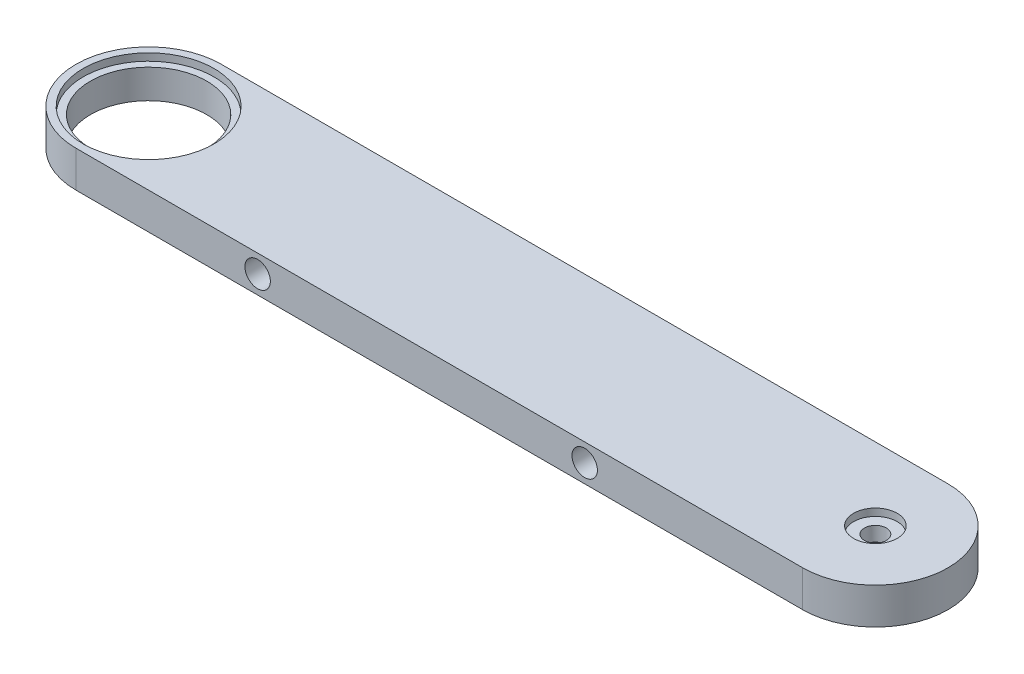
from build123d import *

# Parameters (mm, degrees)
BOSS_EXTRUDE1_DEPTH = 5
SKETCH2_R           = 4
CUT_EXTRUDE1_DEPTH  = 2
SKETCH3_R           = 3
CUT_EXTRUDE2_DEPTH  = 1
SKETCH6_R           = 1.5
CUT_EXTRUDE5_DEPTH  = 71.823724839
SKETCH7_R           = 8
CUT_EXTRUDE6_DEPTH  = 71.887234394
SKETCH8_R           = 9
CUT_EXTRUDE7_DEPTH  = 1
CUT_EXTRUDE8_DEPTH  = 71.887234394
SKETCH10_R          = 1.75
CUT_EXTRUDE9_DEPTH  = 8


with BuildPart() as part:
    # Sketch1 → Boss-Extrude1 (new body)
    with BuildSketch(Plane(origin=(0, 0, 0), x_dir=(1, 0, 0), z_dir=(0, 1, 0))):
        with BuildLine():
            Line((-50, 10), (-60, 10))
            ThreePointArc((-60, 10), (-70, 0), (-60, -10))
            Line((-60, -10), (50, -10))
            ThreePointArc((50, -10), (60, 0), (50, 10))
            Line((50, 10), (-50, 10))
        make_face()
    extrude(amount=BOSS_EXTRUDE1_DEPTH)

    # Sketch2 → Cut-Extrude1 (cut)
    with BuildSketch(Plane.XZ):
        with Locations((50, 0)):
            Circle(SKETCH2_R)
    extrude(amount=-CUT_EXTRUDE1_DEPTH, mode=Mode.SUBTRACT)

    # Sketch3 → Cut-Extrude2 (cut)
    with BuildSketch(Plane(origin=(0, 5, 0), x_dir=(1, 0, 0), z_dir=(0, 1, 0))):
        with Locations((50, 0)):
            Circle(SKETCH3_R)
    extrude(amount=-CUT_EXTRUDE2_DEPTH, mode=Mode.SUBTRACT)

    # Sketch6 → Cut-Extrude5 (cut, through all)
    with BuildSketch(Plane(origin=(0, 4, 0), x_dir=(1, 0, 0), z_dir=(0, 1, 0))):
        with Locations((50, 0)):
            Circle(SKETCH6_R)
    extrude(amount=-CUT_EXTRUDE5_DEPTH, mode=Mode.SUBTRACT)

    # Sketch7 → Cut-Extrude6 (cut, through all)
    with BuildSketch(Plane(origin=(0, 5, 0), x_dir=(1, 0, 0), z_dir=(0, 1, 0))):
        with Locations((-50, 0)):
            Circle(SKETCH7_R)
    extrude(amount=-CUT_EXTRUDE6_DEPTH, mode=Mode.SUBTRACT)

    # Sketch8 → Cut-Extrude7 (cut)
    with BuildSketch(Plane(origin=(0, 5, 0), x_dir=(1, 0, 0), z_dir=(0, 1, 0))):
        with Locations((-50, 0)):
            Circle(SKETCH8_R)
    extrude(amount=-CUT_EXTRUDE7_DEPTH, mode=Mode.SUBTRACT)

    # Sketch9 → Cut-Extrude8 (cut, through all)
    with BuildSketch(Plane(origin=(0, 5, 0), x_dir=(1, 0, 0), z_dir=(0, 1, 0))):
        with BuildLine():
            Line((-50, -10), (-60, -10))
            ThreePointArc((-60, -10), (-70, 0), (-60, 10))
            Line((-60, 10), (-50, 10))
            ThreePointArc((-50, 10), (-60, 0), (-50, -10))
        make_face()
    extrude(amount=-CUT_EXTRUDE8_DEPTH, mode=Mode.SUBTRACT)

    # Sketch10 → Cut-Extrude9 (cut)
    with BuildSketch(Plane.XY.offset(10)):
        with Locations((-25, 2.5)):
            Circle(SKETCH10_R)
        with Locations((20, 2.5)):
            Circle(SKETCH10_R)
    extrude(amount=-CUT_EXTRUDE9_DEPTH, mode=Mode.SUBTRACT)


solid = part.part
